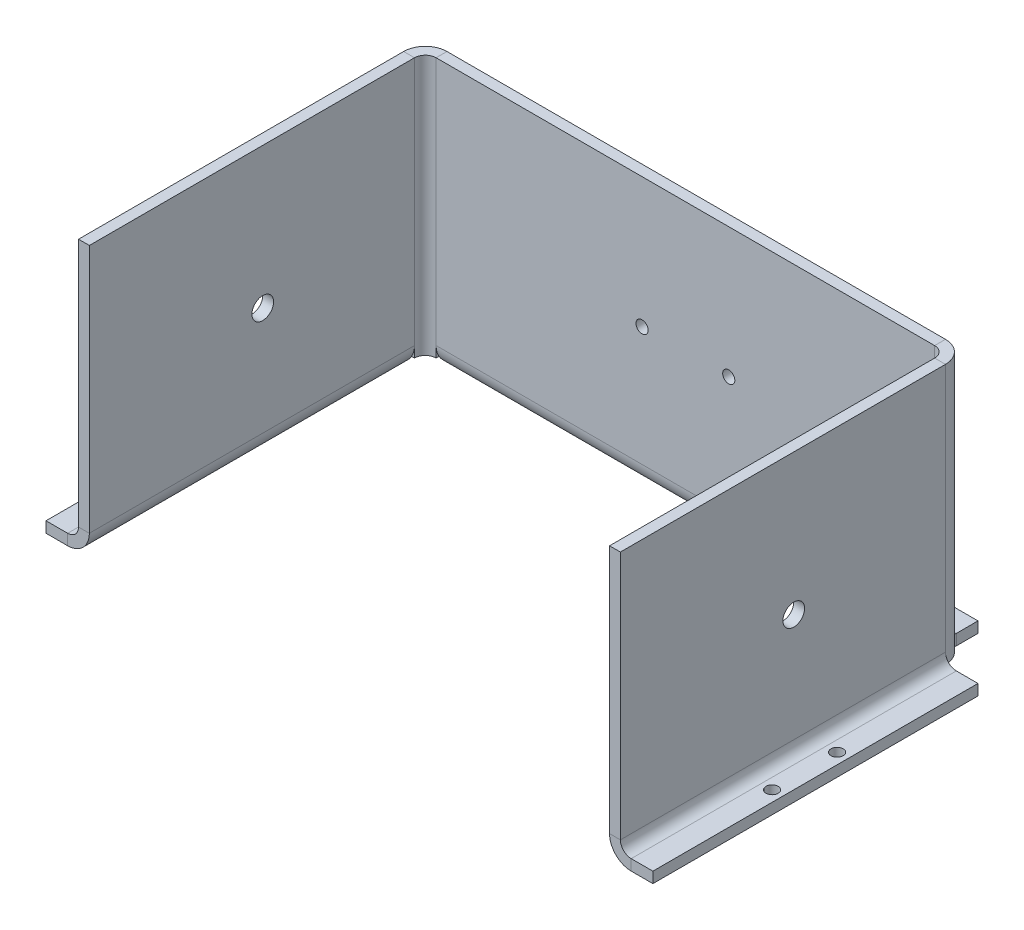
from build123d import *

# Parameters (mm, degrees)
SKETCH1_W                    = 152.4
SKETCH1_H                    = 76.2
BOSS_EXTRUDE1_DEPTH          = 3.175
EDGE_FLANGE5_STRIP_W         = 19.05
EDGE_FLANGE5_STRIP_H         = 3.175
EDGE_FLANGE5_STRIP_CUT_DEPTH = 76.2
EDGE_FLANGE5_DEPTH           = 76.2
EDGE_FLANGE6_STRIP_W         = 19.05
EDGE_FLANGE6_STRIP_H         = 3.175
EDGE_FLANGE6_STRIP_CUT_DEPTH = 76.2
EDGE_FLANGE6_DEPTH           = 76.2
EDGE_FLANGE7_STRIP_W         = 19.05
EDGE_FLANGE7_STRIP_H         = 3.175
EDGE_FLANGE7_STRIP_CUT_DEPTH = 146.05
EDGE_FLANGE7_DEPTH           = 146.05
EDGE_FLANGE8_STRIP_W         = 19.05
EDGE_FLANGE8_STRIP_H         = 3.175
EDGE_FLANGE8_STRIP_CUT_DEPTH = 95.25
EDGE_FLANGE8_DEPTH           = 95.25
EDGE_FLANGE9_STRIP_W         = 19.05
EDGE_FLANGE9_STRIP_H         = 3.175
EDGE_FLANGE9_STRIP_CUT_DEPTH = 95.25
EDGE_FLANGE9_DEPTH           = 95.25
CUT_EXTRUDE1_DEPTH           = 211.820956323
CUT_EXTRUDE1_DEPTH_BACK      = 211.820956323
SKETCH60_R                   = 3.175
CUT_EXTRUDE2_DEPTH           = 207.765399971
CUT_EXTRUDE2_DEPTH_BACK      = 207.765399971
SKETCH61_R                   = 1.778
CUT_EXTRUDE3_DEPTH           = 209.295487229
CUT_EXTRUDE3_DEPTH_BACK      = 209.295487229
SKETCH62_R                   = 1.778


# Sheet-metal steps are written as plain solids
with BuildPart() as part:
    # Sketch1 → Boss-Extrude1 (new body)
    with BuildSketch(Plane.XY):
        with Locations((76.2, 38.1)):
            Rectangle(SKETCH1_W, SKETCH1_H)
    extrude(amount=BOSS_EXTRUDE1_DEPTH)

    # Edge-Flange5 strip (across the edge) → Edge-Flange5 strip cut (cut)
    with BuildSketch(Plane(origin=(152.4, 0, 3.175), x_dir=(-1, 0, 0), z_dir=(0, 1, 0))):
        with Locations((-6.35, -1.5875)):
            Rectangle(EDGE_FLANGE5_STRIP_W, EDGE_FLANGE5_STRIP_H)
    extrude(amount=EDGE_FLANGE5_STRIP_CUT_DEPTH, mode=Mode.SUBTRACT)

    # Edge-Flange5 section (across the edge) → Edge-Flange5 (add)
    with BuildSketch(Plane(origin=(152.4, 0, 3.175), x_dir=(-1, 0, 0), z_dir=(0, 1, 0))):
        with BuildLine():
            Line((-3.175, 3.175), (-3.175, 98.425))
            Line((-3.175, 98.425), (0, 98.425))
            Line((0, 98.425), (0, 3.175))
            ThreePointArc((0, 3.175), (0.92993597, 0.92993597), (3.175, 0))
            Line((3.175, 0), (3.175, -3.175))
            ThreePointArc((3.175, -3.175), (-1.315128061, -1.315128061), (-3.175, 3.175))
        make_face()
    extrude(amount=EDGE_FLANGE5_DEPTH)

    # Edge-Flange6 strip (across the edge) → Edge-Flange6 strip cut (cut)
    with BuildSketch(Plane(origin=(0, 76.2, 3.175), x_dir=(1, 0, 0), z_dir=(0, -1, 0))):
        with Locations((-6.35, -1.5875)):
            Rectangle(EDGE_FLANGE6_STRIP_W, EDGE_FLANGE6_STRIP_H)
    extrude(amount=EDGE_FLANGE6_STRIP_CUT_DEPTH, mode=Mode.SUBTRACT)

    # Edge-Flange6 section (across the edge) → Edge-Flange6 (add)
    with BuildSketch(Plane(origin=(0, 76.2, 3.175), x_dir=(1, 0, 0), z_dir=(0, -1, 0))):
        with BuildLine():
            Line((-3.175, 3.175), (-3.175, 98.425))
            Line((-3.175, 98.425), (0, 98.425))
            Line((0, 98.425), (0, 3.175))
            ThreePointArc((0, 3.175), (0.92993597, 0.92993597), (3.175, 0))
            Line((3.175, 0), (3.175, -3.175))
            ThreePointArc((3.175, -3.175), (-1.315128061, -1.315128061), (-3.175, 3.175))
        make_face()
    extrude(amount=EDGE_FLANGE6_DEPTH)

    # Edge-Flange7 strip (across the edge) → Edge-Flange7 strip cut (cut)
    with BuildSketch(Plane(origin=(149.225, 0, 0), x_dir=(0, 1, 0), z_dir=(-1, 0, 0))):
        with Locations((-6.35, -1.5875)):
            Rectangle(EDGE_FLANGE7_STRIP_W, EDGE_FLANGE7_STRIP_H)
    extrude(amount=EDGE_FLANGE7_STRIP_CUT_DEPTH, mode=Mode.SUBTRACT)

    # Edge-Flange7 section (across the edge) → Edge-Flange7 (add)
    with BuildSketch(Plane(origin=(149.225, 0, 0), x_dir=(0, 1, 0), z_dir=(-1, 0, 0))):
        with BuildLine():
            Line((-3.175, 3.175), (-3.175, 9.525))
            Line((-3.175, 9.525), (0, 9.525))
            Line((0, 9.525), (0, 3.175))
            ThreePointArc((0, 3.175), (0.92993597, 0.92993597), (3.175, 0))
            Line((3.175, 0), (3.175, -3.175))
            ThreePointArc((3.175, -3.175), (-1.315128061, -1.315128061), (-3.175, 3.175))
        make_face()
    extrude(amount=EDGE_FLANGE7_DEPTH)

    # Edge-Flange8 strip (across the edge) → Edge-Flange8 strip cut (cut)
    with BuildSketch(Plane(origin=(155.575, 0, 101.6), x_dir=(0, 1, 0), z_dir=(0, 0, -1))):
        with Locations((-6.35, -1.5875)):
            Rectangle(EDGE_FLANGE8_STRIP_W, EDGE_FLANGE8_STRIP_H)
    extrude(amount=EDGE_FLANGE8_STRIP_CUT_DEPTH, mode=Mode.SUBTRACT)

    # Edge-Flange8 section (across the edge) → Edge-Flange8 (add)
    with BuildSketch(Plane(origin=(155.575, 0, 101.6), x_dir=(0, 1, 0), z_dir=(0, 0, -1))):
        with BuildLine():
            Line((-3.175, 3.175), (-3.175, 9.525))
            Line((-3.175, 9.525), (0, 9.525))
            Line((0, 9.525), (0, 3.175))
            ThreePointArc((0, 3.175), (0.92993597, 0.92993597), (3.175, 0))
            Line((3.175, 0), (3.175, -3.175))
            ThreePointArc((3.175, -3.175), (-1.315128061, -1.315128061), (-3.175, 3.175))
        make_face()
    extrude(amount=EDGE_FLANGE8_DEPTH)

    # Edge-Flange9 strip (across the edge) → Edge-Flange9 strip cut (cut)
    with BuildSketch(Plane(origin=(-3.175, 0, 6.35), x_dir=(0, 1, 0), z_dir=(0, 0, 1))):
        with Locations((-6.35, -1.5875)):
            Rectangle(EDGE_FLANGE9_STRIP_W, EDGE_FLANGE9_STRIP_H)
    extrude(amount=EDGE_FLANGE9_STRIP_CUT_DEPTH, mode=Mode.SUBTRACT)

    # Edge-Flange9 section (across the edge) → Edge-Flange9 (add)
    with BuildSketch(Plane(origin=(-3.175, 0, 6.35), x_dir=(0, 1, 0), z_dir=(0, 0, 1))):
        with BuildLine():
            Line((-3.175, 3.175), (-3.175, 9.525))
            Line((-3.175, 9.525), (0, 9.525))
            Line((0, 9.525), (0, 3.175))
            ThreePointArc((0, 3.175), (0.92993597, 0.92993597), (3.175, 0))
            Line((3.175, 0), (3.175, -3.175))
            ThreePointArc((3.175, -3.175), (-1.315128061, -1.315128061), (-3.175, 3.175))
        make_face()
    extrude(amount=EDGE_FLANGE9_DEPTH)

    # Sketch60 → Cut-Extrude1 (cut, two sides: drawn at the far end of the back side and taken through both)
    with BuildSketch(Plane(origin=(155.575, 0, 0), x_dir=(0, 0, -1), z_dir=(1, 0, 0)).offset(-CUT_EXTRUDE1_DEPTH_BACK)):
        with Locations(Location((-50.8, 34.925, 0), (0, 0, 180))):
            Circle(SKETCH60_R)
    extrude(amount=CUT_EXTRUDE1_DEPTH + CUT_EXTRUDE1_DEPTH_BACK, mode=Mode.SUBTRACT)

    # Sketch61 → Cut-Extrude2 (cut, two sides: drawn at the far end of the back side and taken through both)
    with BuildSketch(Plane.XY.offset(3.175).offset(-CUT_EXTRUDE2_DEPTH_BACK)):
        with Locations((88.9, 38.1)):
            Circle(SKETCH61_R)
        with Locations((63.5, 38.1)):
            Circle(SKETCH61_R)
    extrude(amount=CUT_EXTRUDE2_DEPTH + CUT_EXTRUDE2_DEPTH_BACK, mode=Mode.SUBTRACT)

    # Sketch62 → Cut-Extrude3 (cut, two sides: drawn at the far end of the back side and taken through both)
    with BuildSketch(Plane(origin=(0, 0, 0), x_dir=(1, 0, 0), z_dir=(0, 1, 0)).offset(-CUT_EXTRUDE3_DEPTH_BACK)):
        with Locations(Location((63.5, 6.35, 0), (0, 0, 270))):
            Circle(SKETCH62_R)
        with Locations(Location((-9.525, -44.45, 0), (0, 0, 270))):
            Circle(SKETCH62_R)
        with Locations(Location((-9.525, -63.5, 0), (0, 0, 270))):
            Circle(SKETCH62_R)
        with Locations(Location((161.925, -63.5, 0), (0, 0, 90))):
            Circle(SKETCH62_R)
        with Locations(Location((161.925, -44.45, 0), (0, 0, 90))):
            Circle(SKETCH62_R)
        with Locations(Location((88.9, 6.35, 0), (0, 0, 90))):
            Circle(SKETCH62_R)
    extrude(amount=CUT_EXTRUDE3_DEPTH + CUT_EXTRUDE3_DEPTH_BACK, mode=Mode.SUBTRACT)


solid = part.part
